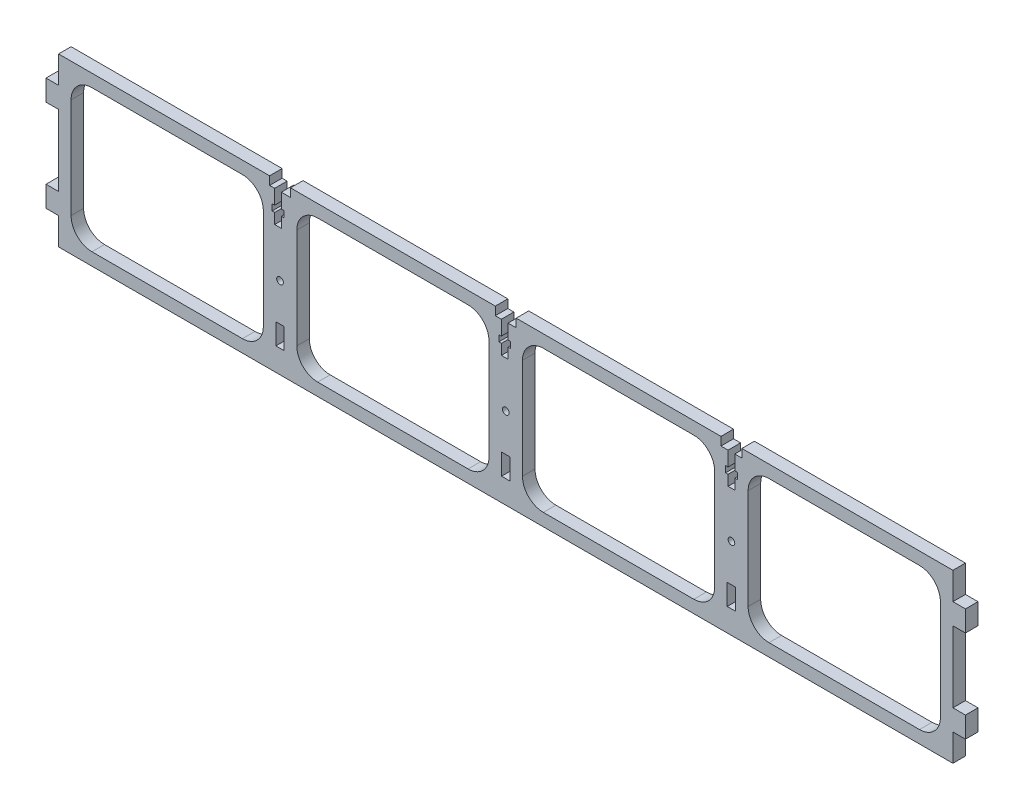
from build123d import *

# Parameters (mm, degrees)
SKETCH1_W           = 428
SKETCH1_H           = 80
BOSS_EXTRUDE1_DEPTH = 6
CUT_EXTRUDE1_REACH  = 219.789
LPATTERN1_COUNT     = 4
LPATTERN1_PITCH     = 108
SKETCH3_R           = 1.6
SKETCH3_W           = 4
SKETCH3_H           = 10
CUT_EXTRUDE2_DEPTH  = 218.788888605
SKETCH4_W           = 6
SKETCH4_H           = 10
BOSS_EXTRUDE2_DEPTH = 6
SKETCH5_W           = 10
SKETCH5_H           = 6
CUT_EXTRUDE3_DEPTH  = 4
CUT_EXTRUDE4_REACH  = 225.687


with BuildPart() as part:
    # Sketch1 → Boss-Extrude1 (new body)
    with BuildSketch(Plane.XY):
        Rectangle(SKETCH1_W, SKETCH1_H)
    extrude(amount=BOSS_EXTRUDE1_DEPTH)

    # Sketch2 → Cut-Extrude1 (cut, up to next)
    with BuildSketch(Plane.XY.offset(6), mode=Mode.PRIVATE) as cut_extrude1_sk1:
        with BuildLine():
            ThreePointArc((-126, -34), (-118.928932188, -31.071067812), (-116, -24))
            Line((-116, -24), (-116, 24))
            ThreePointArc((-116, 24), (-118.928932188, 31.071067812), (-126, 34))
            Line((-126, 34), (-198, 34))
            ThreePointArc((-198, 34), (-205.071067812, 31.071067812), (-208, 24))
            Line((-208, 24), (-208, -24))
            ThreePointArc((-208, -24), (-205.071067812, -31.071067812), (-198, -34))
            Line((-198, -34), (-126, -34))
        make_face()
    cut_extrude1_tool1 = extrude(cut_extrude1_sk1.sketch, amount=-CUT_EXTRUDE1_REACH, mode=Mode.PRIVATE) & part.part
    cut_extrude1 = cut_extrude1_tool1.solids().sort_by_distance((-162, 0, 6))[0]
    add(cut_extrude1, mode=Mode.SUBTRACT)

    # LPattern1: Cut-Extrude1 ×4
    with Locations(*[(i * LPATTERN1_PITCH, 0, 0) for i in range(1, LPATTERN1_COUNT)]):
        add(cut_extrude1, mode=Mode.SUBTRACT)

    # Sketch3 → Cut-Extrude2 (cut, through all)
    with BuildSketch(Plane(origin=(0, 0, 0), x_dir=(-1, 0, 0), z_dir=(0, 0, -1))):
        with Locations((108, -1)):
            Circle(SKETCH3_R)
        with Locations((0, -1)):
            Circle(SKETCH3_R)
        with Locations((-108, -1)):
            Circle(SKETCH3_R)
        with Locations((-108, -24)):
            Rectangle(SKETCH3_W, SKETCH3_H)
        with Locations((0, -24)):
            Rectangle(SKETCH3_W, SKETCH3_H)
        with Locations((108, -24)):
            Rectangle(SKETCH3_W, SKETCH3_H)
    extrude(amount=-CUT_EXTRUDE2_DEPTH, mode=Mode.SUBTRACT)

    # Sketch4 → Boss-Extrude2 (add)
    with BuildSketch(Plane(origin=(0, 0, 0), x_dir=(-1, 0, 0), z_dir=(0, 0, -1))):
        with Locations((-217, 22)):
            Rectangle(SKETCH4_W, SKETCH4_H)
        with Locations((-217, -22)):
            Rectangle(SKETCH4_W, SKETCH4_H)
        with Locations((217, -22)):
            Rectangle(SKETCH4_W, SKETCH4_H)
        with Locations((217, 22)):
            Rectangle(SKETCH4_W, SKETCH4_H)
    extrude(amount=-BOSS_EXTRUDE2_DEPTH)

    # Sketch5 → Cut-Extrude3 (cut)
    with BuildSketch(Plane(origin=(0, 40, 0), x_dir=(1, 0, 0), z_dir=(0, 1, 0))):
        with Locations((-108, -3)):
            Rectangle(SKETCH5_W, SKETCH5_H)
        with Locations((0, -3)):
            Rectangle(SKETCH5_W, SKETCH5_H)
        with Locations((108, -3)):
            Rectangle(SKETCH5_W, SKETCH5_H)
    extrude(amount=-CUT_EXTRUDE3_DEPTH, mode=Mode.SUBTRACT)

    # Sketch6 → Cut-Extrude4 (cut, up to next)
    with BuildSketch(Plane(origin=(0, 0, 0), x_dir=(-1, 0, 0), z_dir=(0, 0, -1)), mode=Mode.PRIVATE) as cut_extrude4_sk1:
        Polygon((-109.6, 36), (-109.6, 29), (-110.8, 29), (-110.8, 26), (-109.6, 26), (-109.6, 21), (-106.4, 21), (-106.4, 26), (-105.2, 26), (-105.2, 29), (-106.4, 29), (-106.4, 36), align=None)
    cut_extrude4_tool1 = extrude(cut_extrude4_sk1.sketch, amount=-CUT_EXTRUDE4_REACH, mode=Mode.PRIVATE) & part.part
    # Sketch6 → Cut-Extrude4 (cut, up to next)
    with BuildSketch(Plane(origin=(0, 0, 0), x_dir=(-1, 0, 0), z_dir=(0, 0, -1)), mode=Mode.PRIVATE) as cut_extrude4_sk2:
        Polygon((-1.1, 29), (-2.3, 29), (-2.3, 26), (-1.1, 26), (-1.1, 21), (2.1, 21), (2.1, 26), (3.3, 26), (3.3, 29), (2.1, 29), (2.1, 36), (-1.1, 36), align=None)
    cut_extrude4_tool2 = extrude(cut_extrude4_sk2.sketch, amount=-CUT_EXTRUDE4_REACH, mode=Mode.PRIVATE) & part.part
    # Sketch6 → Cut-Extrude4 (cut, up to next)
    with BuildSketch(Plane(origin=(0, 0, 0), x_dir=(-1, 0, 0), z_dir=(0, 0, -1)), mode=Mode.PRIVATE) as cut_extrude4_sk3:
        Polygon((107.4, 36), (107.4, 29), (106.2, 29), (106.2, 26), (107.4, 26), (107.4, 21), (110.6, 21), (110.6, 26), (111.8, 26), (111.8, 29), (110.6, 29), (110.6, 36), align=None)
    cut_extrude4_tool3 = extrude(cut_extrude4_sk3.sketch, amount=-CUT_EXTRUDE4_REACH, mode=Mode.PRIVATE) & part.part
    add(cut_extrude4_tool1.solids().sort_by_distance((108, 28.369565, 0))[0], mode=Mode.SUBTRACT)
    add(cut_extrude4_tool2.solids().sort_by_distance((-0.5, 28.369565, 0))[0], mode=Mode.SUBTRACT)
    add(cut_extrude4_tool3.solids().sort_by_distance((-109, 28.369565, 0))[0], mode=Mode.SUBTRACT)


solid = part.part
